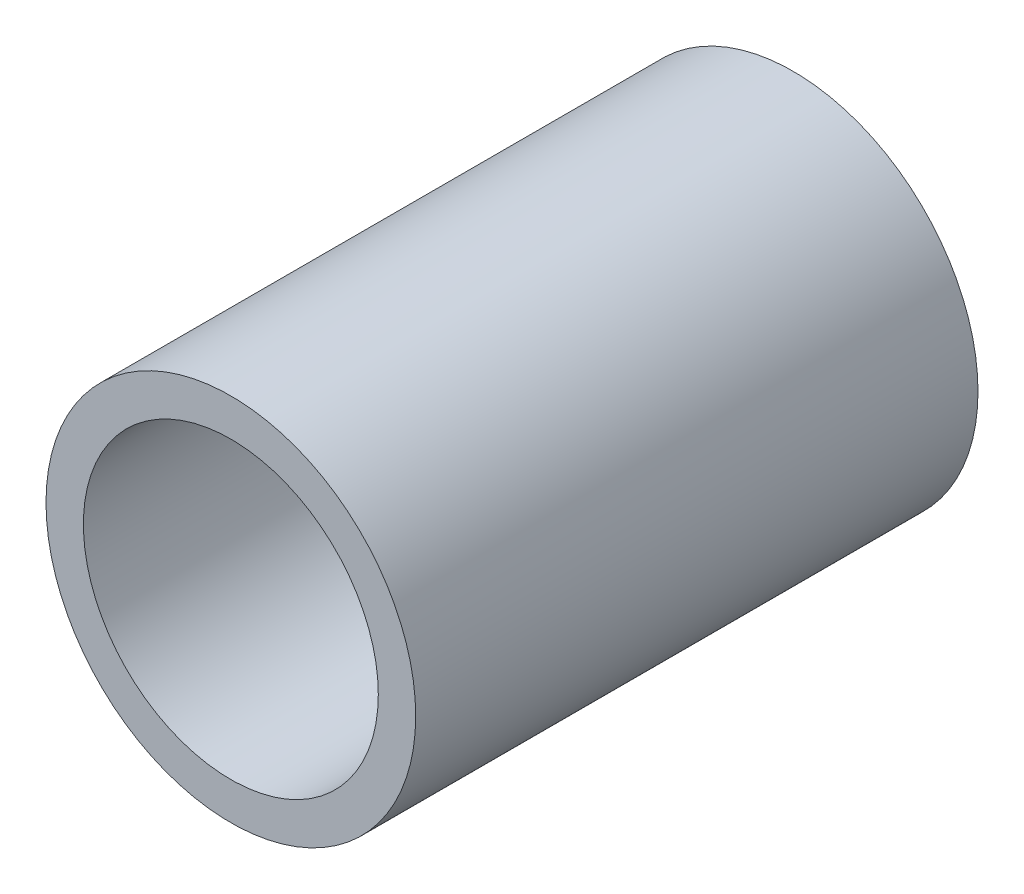
from build123d import *

# Parameters (mm, degrees)
SKETCH1_R           = 16.7005
SKETCH1_R_2         = 13.3223
EXTRUDE_THIN1_DEPTH = 25.4


with BuildPart() as part:
    # Sketch1 → Extrude-Thin1 (new, symmetric)
    with BuildSketch(Plane.XY):
        Circle(SKETCH1_R)
        Circle(SKETCH1_R_2, mode=Mode.SUBTRACT)
    extrude(amount=EXTRUDE_THIN1_DEPTH, both=True)


solid = part.part
